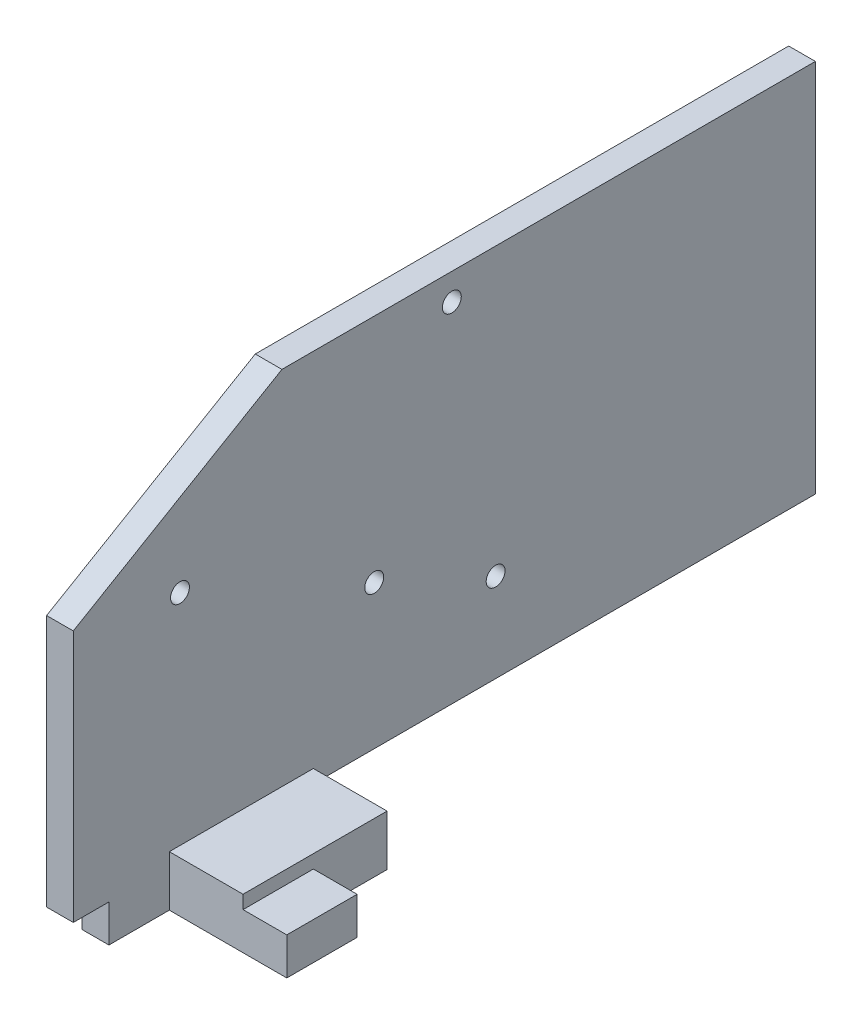
from build123d import *

# Parameters (mm, degrees)
SKETCH2_R           = 2.2479
BOSS_EXTRUDE3_DEPTH = 6.35
SKETCH2_5_W         = 34.29
SKETCH2_5_H         = 12.065
BOSS_EXTRUDE4_DEPTH = 17.5514
SKETCH3_W           = 16.74
SKETCH3_H           = 8.89
BOSS_EXTRUDE5_DEPTH = 10.414


with BuildPart() as part:
    # Sketch2 → Boss-Extrude3 (new body)
    with BuildSketch(Plane(origin=(0, 0, 0), x_dir=(0, 0, -1), z_dir=(1, 0, 0))):
        Polygon((0, 60.116195388), (0, 0), (8.480621378, 0), (8.480621378, -8.89), (57.15, -8.89), (57.15, 0), (176.670010733, 0), (176.670010733, 89.2048), (49.670010733, 89.2048), align=None)
        with Locations((71.642065552, 34.29)):
            Circle(SKETCH2_R, mode=Mode.SUBTRACT)
        with Locations((100.543356523, 21.1455)):
            Circle(SKETCH2_R, mode=Mode.SUBTRACT)
        with Locations((25.4, 55.3212)):
            Circle(SKETCH2_R, mode=Mode.SUBTRACT)
        with Locations((90.119204984, 82.8548)):
            Circle(SKETCH2_R, mode=Mode.SUBTRACT)
    extrude(amount=-BOSS_EXTRUDE3_DEPTH)

    # Sketch2<5> → Boss-Extrude4 (add)
    with BuildSketch(Plane(origin=(0, 0, 0), x_dir=(0, 0, -1), z_dir=(1, 0, 0))):
        with Locations((40.005, -2.8575)):
            Rectangle(SKETCH2_5_W, SKETCH2_5_H)
    extrude(amount=BOSS_EXTRUDE4_DEPTH)

    # Sketch3 → Boss-Extrude5 (add)
    with BuildSketch(Plane(origin=(17.5514, 0, 0), x_dir=(0, 0, -1), z_dir=(1, 0, 0))):
        with Locations((31.23, -4.445)):
            Rectangle(SKETCH3_W, SKETCH3_H)
    extrude(amount=BOSS_EXTRUDE5_DEPTH)


solid = part.part
